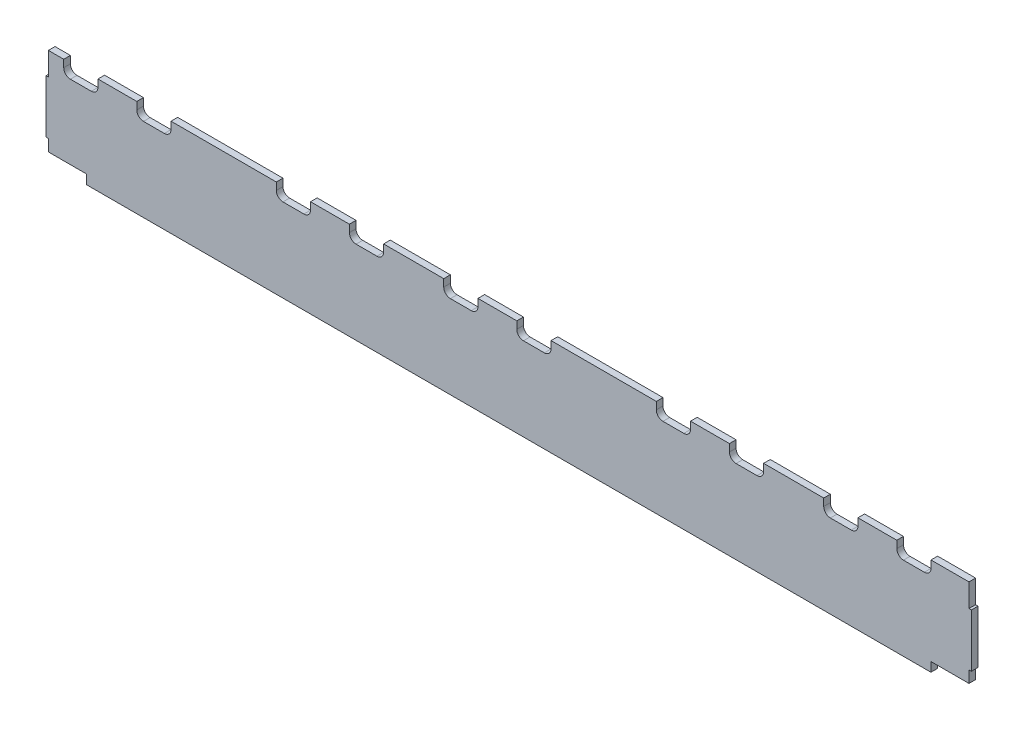
from build123d import *

# Parameters (mm, degrees)
BOSS_EXTRUDE1_DEPTH = 3.175


with BuildPart() as part:
    # Sketch2 → Boss-Extrude1 (new body)
    with BuildSketch(Plane.XY):
        with BuildLine():
            Line((-166.376823509, -157.21600002), (-166.376823509, -167.12200002))
            Line((-166.376823509, -167.12200002), (-166.376823509, -168.26500002))
            Line((-166.376823509, -168.26500002), (-167.519823509, -168.26500002))
            Line((-167.519823509, -168.26500002), (-167.519823509, -193.66500002))
            Line((-167.519823509, -193.66500002), (-166.376823509, -193.66500002))
            Line((-166.376823509, -193.66500002), (-166.376823509, -194.80800002))
            Line((-166.376823509, -194.80800002), (-166.376823509, -199.26100002))
            Line((-166.376823509, -199.26100002), (-148.199823509, -199.26100002))
            Line((-148.199823509, -199.26100002), (-148.199823509, -203.71400002))
            Line((-148.199823509, -203.71400002), (255.426176451, -203.71400002))
            Line((255.426176451, -203.71400002), (255.426176451, -199.26100002))
            Line((255.426176451, -199.26100002), (273.603176451, -199.26100002))
            Line((273.603176451, -199.26100002), (273.603176451, -194.80800002))
            Line((273.603176451, -194.80800002), (273.603176451, -193.66500002))
            Line((273.603176451, -193.66500002), (274.746176451, -193.66500002))
            Line((274.746176451, -193.66500002), (274.746176451, -168.26500002))
            Line((274.746176451, -168.26500002), (273.603176451, -168.26500002))
            Line((273.603176451, -168.26500002), (273.603176451, -167.12200002))
            Line((273.603176451, -167.12200002), (273.603176451, -157.21600002))
            Line((273.603176451, -157.21600002), (255.463301471, -157.21600002))
            Line((255.463301471, -157.21600002), (255.463301471, -160.70800002))
            ThreePointArc((255.463301471, -160.70800002), (254.533365501, -162.95306405), (252.288301471, -163.88300002))
            Line((252.288301471, -163.88300002), (242.288301471, -163.88300002))
            ThreePointArc((242.288301471, -163.88300002), (240.04323744, -162.95306405), (239.113301471, -160.70800002))
            Line((239.113301471, -160.70800002), (239.113301471, -157.21600002))
            Line((239.113301471, -157.21600002), (220.538301471, -157.21600002))
            Line((220.538301471, -157.21600002), (220.538301471, -160.70800002))
            ThreePointArc((220.538301471, -160.70800002), (219.608365501, -162.95306405), (217.363301471, -163.88300002))
            Line((217.363301471, -163.88300002), (207.363301471, -163.88300002))
            ThreePointArc((207.363301471, -163.88300002), (205.11823744, -162.95306405), (204.188301471, -160.70800002))
            Line((204.188301471, -160.70800002), (204.188301471, -157.21600002))
            Line((204.188301471, -157.21600002), (175.452051471, -157.21600002))
            Line((175.452051471, -157.21600002), (175.452051471, -160.70800002))
            ThreePointArc((175.452051471, -160.70800002), (174.522115501, -162.95306405), (172.277051471, -163.88300002))
            Line((172.277051471, -163.88300002), (162.277051471, -163.88300002))
            ThreePointArc((162.277051471, -163.88300002), (160.03198744, -162.95306405), (159.102051471, -160.70800002))
            Line((159.102051471, -160.70800002), (159.102051471, -157.21600002))
            Line((159.102051471, -157.21600002), (140.527051471, -157.21600002))
            Line((140.527051471, -157.21600002), (140.527051471, -160.70800002))
            ThreePointArc((140.527051471, -160.70800002), (139.597115501, -162.95306405), (137.352051471, -163.88300002))
            Line((137.352051471, -163.88300002), (127.352051471, -163.88300002))
            ThreePointArc((127.352051471, -163.88300002), (125.10698744, -162.95306405), (124.177051471, -160.70800002))
            Line((124.177051471, -160.70800002), (124.177051471, -157.21600002))
            Line((124.177051471, -157.21600002), (73.849301471, -157.21600002))
            Line((73.849301471, -157.21600002), (73.849301471, -160.70800002))
            ThreePointArc((73.849301471, -160.70800002), (72.919365501, -162.95306405), (70.674301471, -163.88300002))
            Line((70.674301471, -163.88300002), (60.674301471, -163.88300002))
            ThreePointArc((60.674301471, -163.88300002), (58.42923744, -162.95306405), (57.499301471, -160.70800002))
            Line((57.499301471, -160.70800002), (57.499301471, -157.21600002))
            Line((57.499301471, -157.21600002), (38.924301471, -157.21600002))
            Line((38.924301471, -157.21600002), (38.924301471, -160.70800002))
            ThreePointArc((38.924301471, -160.70800002), (37.994365501, -162.95306405), (35.749301471, -163.88300002))
            Line((35.749301471, -163.88300002), (25.749301471, -163.88300002))
            ThreePointArc((25.749301471, -163.88300002), (23.50423744, -162.95306405), (22.574301471, -160.70800002))
            Line((22.574301471, -160.70800002), (22.574301471, -157.21600002))
            Line((22.574301471, -157.21600002), (-6.161948529, -157.21600002))
            Line((-6.161948529, -157.21600002), (-6.161948529, -160.70800002))
            ThreePointArc((-6.161948529, -160.70800002), (-7.091884499, -162.95306405), (-9.336948529, -163.88300002))
            Line((-9.336948529, -163.88300002), (-19.336948529, -163.88300002))
            ThreePointArc((-19.336948529, -163.88300002), (-21.58201256, -162.95306405), (-22.511948529, -160.70800002))
            Line((-22.511948529, -160.70800002), (-22.511948529, -157.21600002))
            Line((-22.511948529, -157.21600002), (-41.086948529, -157.21600002))
            Line((-41.086948529, -157.21600002), (-41.086948529, -160.70800002))
            ThreePointArc((-41.086948529, -160.70800002), (-42.016884499, -162.95306405), (-44.261948529, -163.88300002))
            Line((-44.261948529, -163.88300002), (-54.261948529, -163.88300002))
            ThreePointArc((-54.261948529, -163.88300002), (-56.50701256, -162.95306405), (-57.436948529, -160.70800002))
            Line((-57.436948529, -160.70800002), (-57.436948529, -157.21600002))
            Line((-57.436948529, -157.21600002), (-107.764698529, -157.21600002))
            Line((-107.764698529, -157.21600002), (-107.764698529, -160.70800002))
            ThreePointArc((-107.764698529, -160.70800002), (-108.694634499, -162.95306405), (-110.939698529, -163.88300002))
            Line((-110.939698529, -163.88300002), (-120.939698529, -163.88300002))
            ThreePointArc((-120.939698529, -163.88300002), (-123.18476256, -162.95306405), (-124.114698529, -160.70800002))
            Line((-124.114698529, -160.70800002), (-124.114698529, -157.21600002))
            Line((-124.114698529, -157.21600002), (-142.689698529, -157.21600002))
            Line((-142.689698529, -157.21600002), (-142.689698529, -160.70800002))
            ThreePointArc((-142.689698529, -160.70800002), (-143.619634499, -162.95306405), (-145.864698529, -163.88300002))
            Line((-145.864698529, -163.88300002), (-155.864698529, -163.88300002))
            ThreePointArc((-155.864698529, -163.88300002), (-158.10976256, -162.95306405), (-159.039698529, -160.70800002))
            Line((-159.039698529, -160.70800002), (-159.039698529, -157.21600002))
            Line((-159.039698529, -157.21600002), (-166.376823509, -157.21600002))
        make_face()
    extrude(amount=BOSS_EXTRUDE1_DEPTH)


solid = part.part
